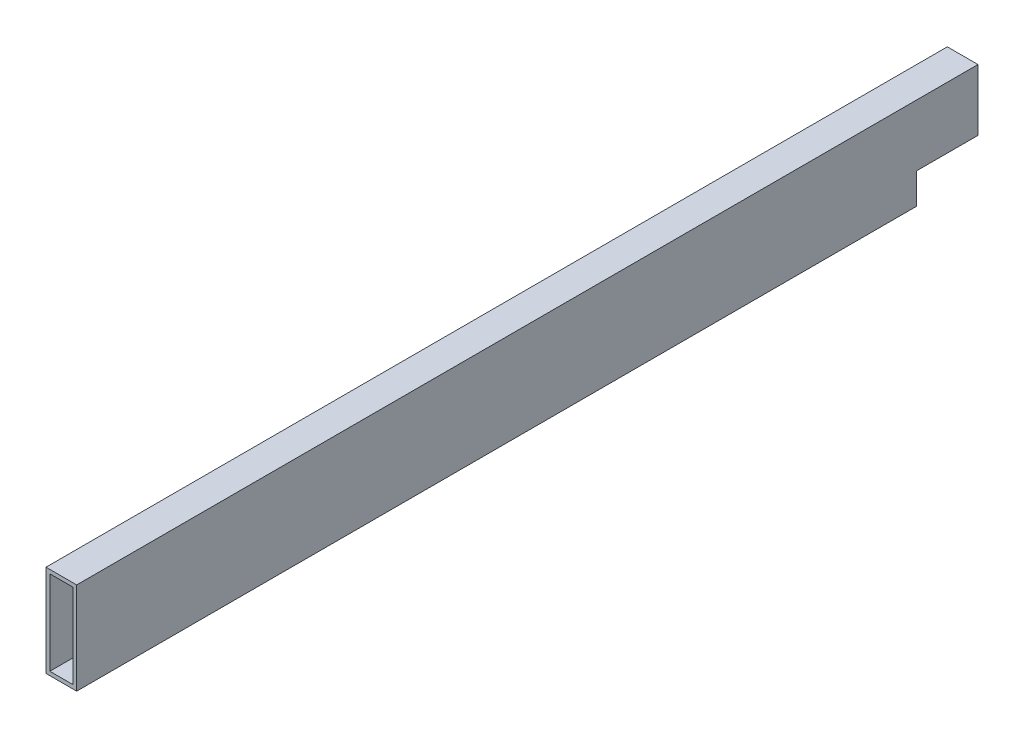
from build123d import *

# Parameters (mm, degrees)
SKETCH1_W           = 25.4
SKETCH1_H           = 76.2
BOSS_EXTRUDE1_DEPTH = 372.999
SHELL1_T            = -3.175
SKETCH2_W           = 50.8
SKETCH2_H           = 25.4
CUT_EXTRUDE1_DEPTH  = 376.799180416


with BuildPart() as part:
    # Sketch1 → Boss-Extrude1 (new, symmetric)
    with BuildSketch(Plane.XY):
        Rectangle(SKETCH1_W, SKETCH1_H)
    extrude(amount=BOSS_EXTRUDE1_DEPTH, both=True)

    # Shell1
    shell1_openings = [part.faces().sort_by_distance(p)[0] for p in [
        (0, 0, -372.999),
        (0, 0, 372.999),
    ]]
    offset(amount=SHELL1_T, openings=shell1_openings, kind=Kind.INTERSECTION)

    # Sketch2 → Cut-Extrude1 (cut, through all)
    with BuildSketch(Plane(origin=(12.7, 0, 0), x_dir=(0, 0, -1), z_dir=(1, 0, 0))):
        with Locations((347.599, -25.4)):
            Rectangle(SKETCH2_W, SKETCH2_H)
    extrude(amount=-CUT_EXTRUDE1_DEPTH, mode=Mode.SUBTRACT)


solid = part.part
